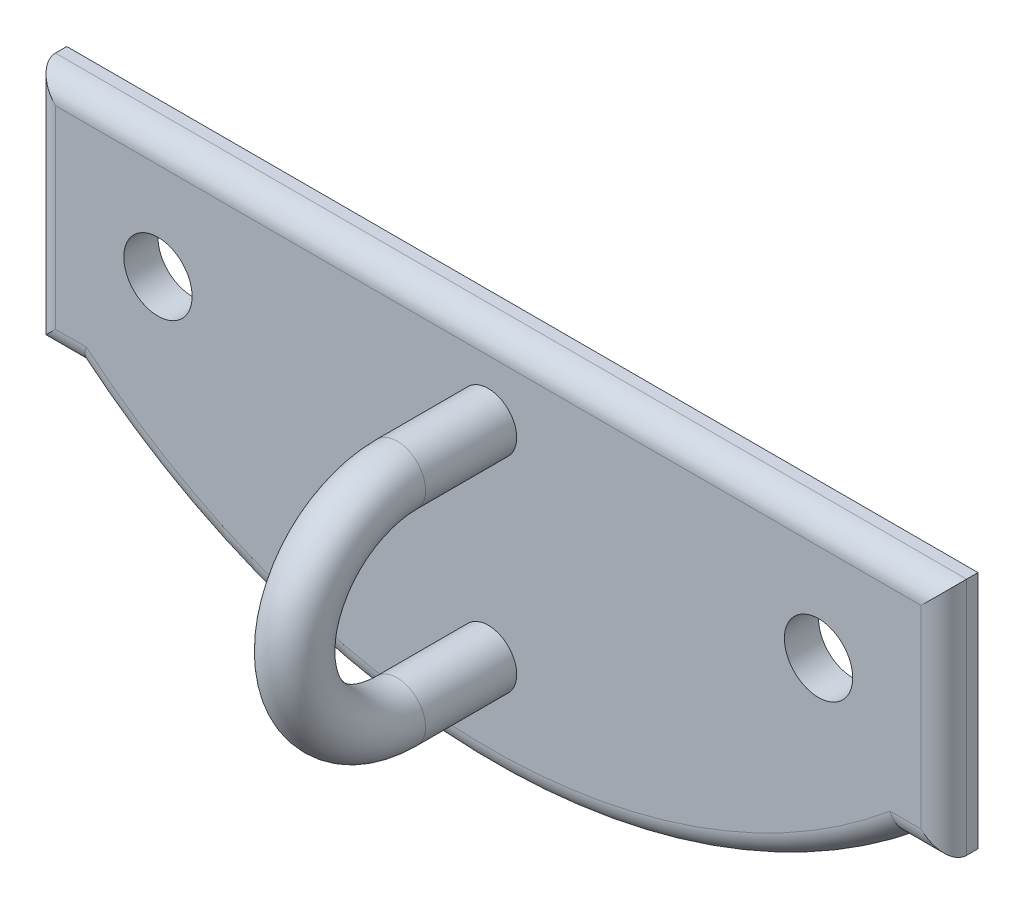
from build123d import *

# Parameters (mm, degrees)
BOSS_EXTRUDE1_DEPTH = 1.5
SKETCH2_R           = 1.5
CUT_EXTRUDE1_DEPTH  = 1.5
SKETCH3_R           = 1.25
FILLET1_R           = 1


with BuildPart() as part:
    # Sketch1 → Boss-Extrude1 (new body)
    with BuildSketch(Plane.XY):
        with BuildLine():
            Line((0, 0), (20, 0))
            Line((20, 0), (20, -10.5))
            Line((20, -10.5), (18, -10.5))
            ThreePointArc((18, -10.5), (0, -16.9094223), (-18, -10.5))
            Line((-18, -10.5), (-20, -10.5))
            Line((-20, -10.5), (-20, 0))
            Line((-20, 0), (0, 0))
        make_face()
    extrude(amount=BOSS_EXTRUDE1_DEPTH)

    # Sketch2 → Cut-Extrude1 (cut)
    with BuildSketch(Plane.XY.offset(1.5)):
        with Locations((-14.5, -5.25)):
            Circle(SKETCH2_R)
        with Locations((14.5, -5.25)):
            Circle(SKETCH2_R)
    extrude(amount=-CUT_EXTRUDE1_DEPTH, mode=Mode.SUBTRACT)

    # Sweep2: sweep along a path in Sketch4
    with BuildLine(Plane(origin=(0, 0, 0), x_dir=(0, 0, -1), z_dir=(1, 0, 0))) as sweep2_path:
        Line((-1.5, -3.5), (-5.5, -3.5))
        ThreePointArc((-5.5, -3.5), (-10, -8), (-5.5, -12.5))
        Line((-5.5, -12.5), (-1.5, -12.5))
    # Sketch3 → Sweep2 (sweep)
    with BuildSketch(Plane.XY.offset(1.5)):
        with Locations((0, -12.5)):
            Circle(SKETCH3_R)
    sweep(path=sweep2_path.line)

    # Fillet1
    fillet1_edges = [part.edges().sort_by_distance(p)[0] for p in [
        (0, 0, 1.5),
        (20, -5.25, 1.5),
        (19, -10.5, 1.5),
        (0, -16.9094223, 1.5),
        (-19, -10.5, 1.5),
        (-20, -5.25, 1.5),
    ]]
    fillet(fillet1_edges, radius=FILLET1_R)


solid = part.part
